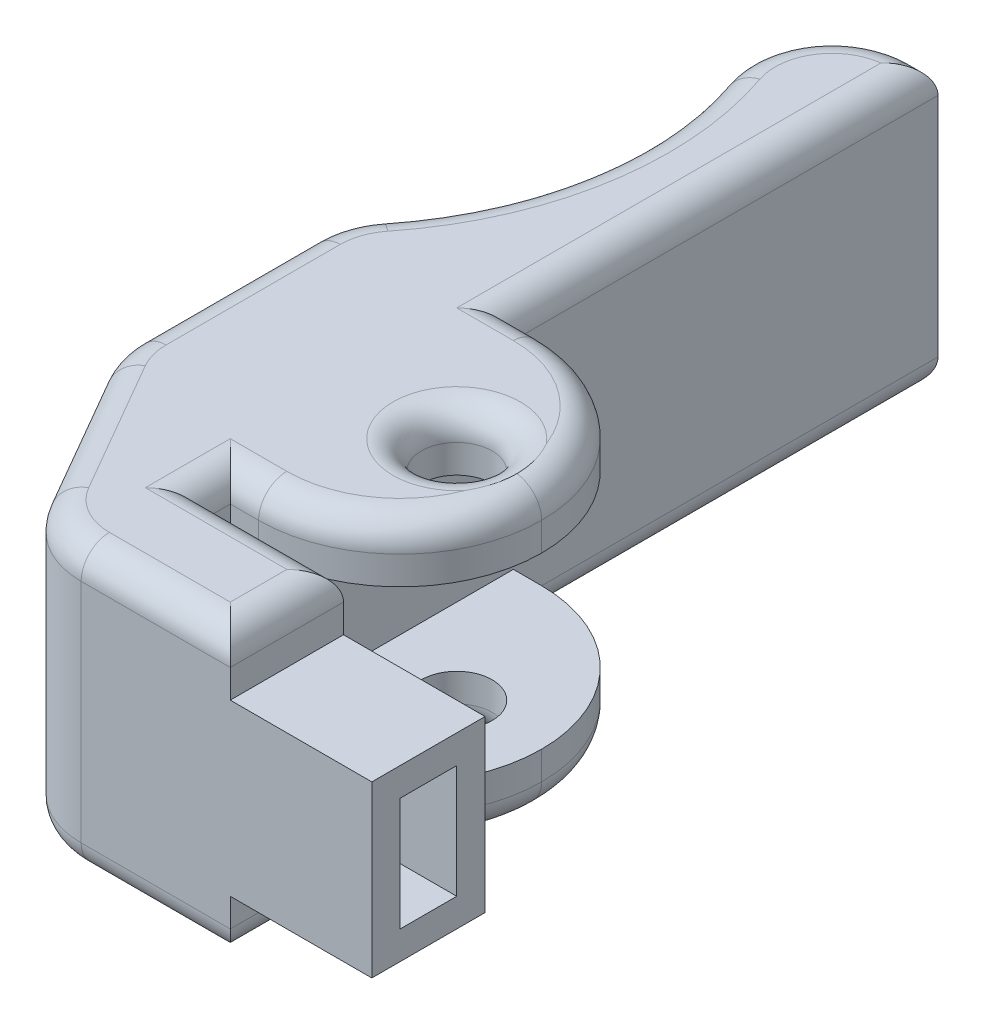
from build123d import *

# Parameters (mm, degrees)
CROQUIS1_W                 = 6
CROQUIS1_H                 = 10
CROQUIS1_R                 = 1.25
SALIENTE_EXTRUIR1_DEPTH    = 5
REDONDEO1_R                = 5
CROQUIS2_W                 = 4
CROQUIS2_H                 = 2
CORTAR_EXTRUIR1_DEPTH      = 5
CORTAR_EXTRUIR2_DEPTH      = 5
CORTAR_EXTRUIR2_DEPTH_BACK = 3
CROQUIS3_W                 = 5
CROQUIS3_H                 = 6
CROQUIS4_W                 = 2
CROQUIS4_H                 = 4
CORTAR_EXTRUIR3_DEPTH      = 2
CORTAR_EXTRUIR4_DEPTH      = 16
REDONDEO2_R                = 3
REDONDEO3_R                = 3
REDONDEO4_R                = 1


# Some blends are built 0.0001 mm under size
with BuildPart() as part:
    # Croquis1 → Saliente-Extruir1 (new, symmetric)
    # profile 1 of 2: a face of its own
    with BuildSketch(Plane(origin=(0, 0, 0), x_dir=(1, 0, 0), z_dir=(0, 1, 0))):
        Polygon((-3, -6), (-3, -5), (-3, 5), (-3, 20), (-9, 20), (-9, -3.07179677), (-5, -10), (7, -10), (7, -6), align=None)
    # profile 2 of 2: a face of its own
    with BuildSketch(Plane(origin=(0, 0, 0), x_dir=(1, 0, 0), z_dir=(0, 1, 0))):
        Rectangle(CROQUIS1_W, CROQUIS1_H)
        with Locations(Location((0, 0, 0), (0, 0, 270))):
            Circle(CROQUIS1_R, mode=Mode.SUBTRACT)
    extrude(amount=SALIENTE_EXTRUIR1_DEPTH, both=True)

    # Redondeo1
    redondeo1_edges = [part.edges().sort_by_distance(p)[0] for p in [
        (3, 0, 5),
        (3, 0, -5),
    ]]
    fillet(redondeo1_edges, radius=REDONDEO1_R - 0.0001)  # a hair under: the kernel refuses the full size

    # Croquis2 → Cortar-Extruir1 (cut)
    with BuildSketch(Plane(origin=(7, 0, 0), x_dir=(0, 0, -1), z_dir=(1, 0, 0))):
        with Locations((-8, 4)):
            Rectangle(CROQUIS2_W, CROQUIS2_H)
        with Locations((-8, -4)):
            Rectangle(CROQUIS2_W, CROQUIS2_H)
    extrude(amount=-CORTAR_EXTRUIR1_DEPTH, mode=Mode.SUBTRACT)

    # Croquis3 → Cortar-Extruir2 (cut, two sides: drawn at the far end of the back side and taken through both)
    with BuildSketch(Plane(origin=(0, 0, 0), x_dir=(0, 0, -1), z_dir=(1, 0, 0)).offset(-CORTAR_EXTRUIR2_DEPTH_BACK)):
        with Locations((2.5, 0)):
            Rectangle(CROQUIS3_W, CROQUIS3_H)
        with Locations((-2.5, 0)):
            Rectangle(CROQUIS3_W, CROQUIS3_H)
    extrude(amount=CORTAR_EXTRUIR2_DEPTH + CORTAR_EXTRUIR2_DEPTH_BACK, mode=Mode.SUBTRACT)

    # Croquis4 → Cortar-Extruir3 (cut)
    with BuildSketch(Plane(origin=(7, 0, 0), x_dir=(0, 0, -1), z_dir=(1, 0, 0))):
        with Locations((-8, 0)):
            Rectangle(CROQUIS4_W, CROQUIS4_H)
    extrude(amount=-CORTAR_EXTRUIR3_DEPTH, mode=Mode.SUBTRACT)

    # Croquis5 → Cortar-Extruir4 (cut, symmetric)
    with BuildSketch(Plane(origin=(0, 0, 0), x_dir=(1, 0, 0), z_dir=(0, 1, 0))):
        with BuildLine():
            Line((-9, 20), (-9, 5))
            ThreePointArc((-9, 5), (-6, 12.5), (-9, 20))
        make_face()
    extrude(amount=CORTAR_EXTRUIR4_DEPTH, both=True, mode=Mode.SUBTRACT)

    # Redondeo2
    redondeo2_edges = [part.edges().sort_by_distance(p)[0] for p in [
        (-9, 0, -20),
    ]]
    fillet(redondeo2_edges, radius=REDONDEO2_R)

    # Redondeo3
    redondeo3_edges = [part.edges().sort_by_distance(p)[0] for p in [
        (-9, 0, -5),
        (-5, 0, 10),
        (-9, 0, 3.07179677),
    ]]
    fillet(redondeo3_edges, radius=REDONDEO3_R)

    # Redondeo4
    # the kernel refuses this fillet: 1 mm, written as the material it takes off along each edge
    with BuildSketch(Plane(origin=(2, -5, 12.5), x_dir=(-1, 0, 0), z_dir=(0, 0, -1)), Plane(origin=(2, 5, 3.5), x_dir=(-1, 0, 0), z_dir=(0, 0, 1))) as redondeo4_piece_1:
        with BuildLine():
            CenterArc((REDONDEO4_R, REDONDEO4_R), REDONDEO4_R, 180, 90)
            Line((0, REDONDEO4_R), (0, 0))
            Line((0, 0), (REDONDEO4_R, 0))
        make_face()
    extrude(amount=9, mode=Mode.SUBTRACT)
    with BuildSketch(Plane(origin=(4.5, -5, 6), x_dir=(0, 0, 1), z_dir=(-1, 0, 0)), Plane(origin=(4.5, 5, 6), x_dir=(0, -1, 0), z_dir=(-1, 0, 0))) as redondeo4_piece_2:
        with BuildLine():
            CenterArc((REDONDEO4_R, REDONDEO4_R), REDONDEO4_R, 180, 90)
            Line((0, REDONDEO4_R), (0, 0))
            Line((0, 0), (REDONDEO4_R, 0))
        make_face()
    extrude(amount=7.5, mode=Mode.SUBTRACT)
    with BuildSketch(Plane(origin=(-3, -5, 6), x_dir=(-1, 0, 0), z_dir=(0, 0, -1))) as redondeo4_piece_3:
        with BuildLine():
            CenterArc((REDONDEO4_R, REDONDEO4_R), REDONDEO4_R, 180, 90)
            Line((0, REDONDEO4_R), (0, 0))
            Line((0, 0), (REDONDEO4_R, 0))
        make_face()
    extrude(amount=1, mode=Mode.SUBTRACT)
    with BuildSketch(Plane(origin=(-3, -5, 5), x_dir=(0, 0, -1), z_dir=(1, 0, 0)), Plane(origin=(-1.9999, -5, -5), x_dir=(0, 0, 1), z_dir=(-1, 0, 0))) as redondeo4_piece_4:
        with BuildLine():
            CenterArc((REDONDEO4_R, REDONDEO4_R), REDONDEO4_R, 180, 90)
            Line((0, REDONDEO4_R), (0, 0))
            Line((0, 0), (REDONDEO4_R, 0))
        make_face()
    extrude(amount=1.0001, mode=Mode.SUBTRACT)
    with BuildSketch(Plane(origin=(-1.9999, -5, 0.0001), x_dir=(0, 0, 1), z_dir=(-1, 0, 0))) as redondeo4_piece_5:
        with BuildLine():
            CenterArc((4.9999 - REDONDEO4_R, REDONDEO4_R), REDONDEO4_R, 270, 90)
            Line((4.9999, REDONDEO4_R), (4.9999, 0))
            Line((4.9999, 0), (4.9999 - REDONDEO4_R, 0))
        make_face()
    revolve(axis=Axis((-1.9999, -5, 0.0001), (0, 1, 0)), revolution_arc=90, mode=Mode.SUBTRACT)
    with BuildSketch(Plane(origin=(-1.9999, -5, -0.0001), x_dir=(1, 0, 0), z_dir=(0, 0, 1))) as redondeo4_piece_6:
        with BuildLine():
            CenterArc((4.9999 - REDONDEO4_R, REDONDEO4_R), REDONDEO4_R, 270, 90)
            Line((4.9999, REDONDEO4_R), (4.9999, 0))
            Line((4.9999, 0), (4.9999 - REDONDEO4_R, 0))
        make_face()
    revolve(axis=Axis((-1.9999, -5, -0.0001), (0, 1, 0)), revolution_arc=90, mode=Mode.SUBTRACT)
    with BuildSketch(Plane(origin=(-3, -5, -5), x_dir=(-1, 0, 0), z_dir=(0, 0, -1))) as redondeo4_piece_7:
        with BuildLine():
            CenterArc((REDONDEO4_R, REDONDEO4_R), REDONDEO4_R, 180, 90)
            Line((0, REDONDEO4_R), (0, 0))
            Line((0, 0), (REDONDEO4_R, 0))
        make_face()
    extrude(amount=17.5, mode=Mode.SUBTRACT)
    with BuildSketch(Plane(origin=(-3.75, -5, -17), x_dir=(-0.9459459459459457, 0, 0.32432432432432523), z_dir=(0.32432432432432523, 0, 0.9459459459459457))) as redondeo4_piece_8:
        with BuildLine():
            CenterArc((3 - REDONDEO4_R, -REDONDEO4_R), REDONDEO4_R, 0, 90)
            Line((3, -REDONDEO4_R), (3, 0))
            Line((3, 0), (3 - REDONDEO4_R, 0))
        make_face()
    revolve(axis=Axis((-3.75, -5, -17), (0, -1, 0)), revolution_arc=108.924644416, mode=Mode.SUBTRACT)
    with BuildSketch(Plane(origin=(-16.875, -5, -12.5), x_dir=(0.7837837837837833, 0, 0.6210337996257335), z_dir=(-0.6210337996257335, 0, 0.7837837837837833))) as redondeo4_piece_9:
        with BuildLine():
            CenterArc((10.875 + REDONDEO4_R, REDONDEO4_R), REDONDEO4_R, 180, 90)
            Line((10.875, REDONDEO4_R), (10.875, 0))
            Line((10.875, 0), (10.875 + REDONDEO4_R, 0))
        make_face()
    revolve(axis=Axis((-16.875, -5, -12.5), (0, 1, 0)), revolution_arc=57.316311778, mode=Mode.SUBTRACT)
    with BuildSketch(Plane(origin=(-6, -5, -3.88315603), x_dir=(-0.7837837837837837, 0, -0.621033799625733), z_dir=(0.621033799625733, 0, -0.7837837837837837))) as redondeo4_piece_10:
        with BuildLine():
            CenterArc((3 - REDONDEO4_R, REDONDEO4_R), REDONDEO4_R, 270, 90)
            Line((3, REDONDEO4_R), (3, 0))
            Line((3, 0), (3 - REDONDEO4_R, 0))
        make_face()
    revolve(axis=Axis((-6, -5, -3.88315603), (0, 1, 0)), revolution_arc=38.391667362, mode=Mode.SUBTRACT)
    with BuildSketch(Plane(origin=(-9, -5, -3.88315603), x_dir=(1, 0, 0), z_dir=(0, 0, 1)), Plane(origin=(-9, 5, -3.88315603), x_dir=(0, -1, 0), z_dir=(0, 0, 1))) as redondeo4_piece_11:
        with BuildLine():
            CenterArc((REDONDEO4_R, REDONDEO4_R), REDONDEO4_R, 180, 90)
            Line((0, REDONDEO4_R), (0, 0))
            Line((0, 0), (REDONDEO4_R, 0))
        make_face()
    extrude(amount=6.151105223, mode=Mode.SUBTRACT)
    with BuildSketch(Plane(origin=(-6, -5, 2.267949192), x_dir=(-1, 0, 0), z_dir=(0, 0, -1))) as redondeo4_piece_12:
        with BuildLine():
            CenterArc((3 - REDONDEO4_R, REDONDEO4_R), REDONDEO4_R, 270, 90)
            Line((3, REDONDEO4_R), (3, 0))
            Line((3, 0), (3 - REDONDEO4_R, 0))
        make_face()
    revolve(axis=Axis((-6, -5, 2.267949192), (0, 1, 0)), revolution_arc=30, mode=Mode.SUBTRACT)
    with BuildSketch(Plane(origin=(-8.598076211, -5, 3.767949192), x_dir=(0.8660254037844396, 0, -0.4999999999999982), z_dir=(0.4999999999999983, 0, 0.8660254037844397)), Plane(origin=(-8.598076211, 5, 3.767949192), x_dir=(0, -1, 0), z_dir=(0.4999999999999983, 0, 0.8660254037844397))) as redondeo4_piece_13:
        with BuildLine():
            CenterArc((REDONDEO4_R, REDONDEO4_R), REDONDEO4_R, 180, 90)
            Line((0, REDONDEO4_R), (0, 0))
            Line((0, 0), (REDONDEO4_R, 0))
        make_face()
    extrude(amount=5.464101615, mode=Mode.SUBTRACT)
    with BuildSketch(Plane(origin=(-3.267949192, -5, 7), x_dir=(-0.8660254037844399, 0, 0.4999999999999977), z_dir=(-0.4999999999999977, 0, -0.8660254037844399))) as redondeo4_piece_14:
        with BuildLine():
            CenterArc((3 - REDONDEO4_R, REDONDEO4_R), REDONDEO4_R, 270, 90)
            Line((3, REDONDEO4_R), (3, 0))
            Line((3, 0), (3 - REDONDEO4_R, 0))
        make_face()
    revolve(axis=Axis((-3.267949192, -5, 7), (0, 1, 0)), revolution_arc=60, mode=Mode.SUBTRACT)
    with BuildSketch(Plane(origin=(-3.267949192, -5, 10), x_dir=(0, 0, -1), z_dir=(1, 0, 0)), Plane(origin=(-3.267949192, 5, 10), x_dir=(0, -1, 0), z_dir=(1, 0, 0))) as redondeo4_piece_15:
        with BuildLine():
            CenterArc((REDONDEO4_R, REDONDEO4_R), REDONDEO4_R, 180, 90)
            Line((0, REDONDEO4_R), (0, 0))
            Line((0, 0), (REDONDEO4_R, 0))
        make_face()
    extrude(amount=7.767949192, mode=Mode.SUBTRACT)
    with BuildSketch(Plane(origin=(0, -5, 0), x_dir=(0, 0, 1), z_dir=(-1, 0, 0))) as redondeo4_piece_16:
        with BuildLine():
            CenterArc((1.25 + REDONDEO4_R, REDONDEO4_R), REDONDEO4_R, 180, 90)
            Line((1.25, REDONDEO4_R), (1.25, 0))
            Line((1.25, 0), (1.25 + REDONDEO4_R, 0))
        make_face()
    revolve(axis=Axis((0, -5, 0), (0, 1, 0)), mode=Mode.SUBTRACT)
    with BuildSketch(Plane(origin=(0, 5, 0), x_dir=(0, 0, 1), z_dir=(-1, 0, 0))) as redondeo4_piece_17:
        with BuildLine():
            CenterArc((1.25 + REDONDEO4_R, -REDONDEO4_R), REDONDEO4_R, 90, 90)
            Line((1.25, -REDONDEO4_R), (1.25, 0))
            Line((1.25, 0), (1.25 + REDONDEO4_R, 0))
        make_face()
    revolve(axis=Axis((0, 5, 0), (0, 1, 0)), mode=Mode.SUBTRACT)
    with BuildSketch(Plane(origin=(-6, 5, 2.267949192), x_dir=(-1, 0, 0), z_dir=(0, 0, -1))) as redondeo4_piece_18:
        with BuildLine():
            CenterArc((3 - REDONDEO4_R, -REDONDEO4_R), REDONDEO4_R, 0, 90)
            Line((3 - REDONDEO4_R, 0), (3, 0))
            Line((3, 0), (3, -REDONDEO4_R))
        make_face()
    revolve(axis=Axis((-6, 5, 2.267949192), (0, 1, 0)), revolution_arc=30, mode=Mode.SUBTRACT)
    with BuildSketch(Plane(origin=(-6, 5, -3.88315603), x_dir=(-0.7837837837837837, 0, -0.621033799625733), z_dir=(0.621033799625733, 0, -0.7837837837837837))) as redondeo4_piece_19:
        with BuildLine():
            CenterArc((3 - REDONDEO4_R, -REDONDEO4_R), REDONDEO4_R, 0, 90)
            Line((3 - REDONDEO4_R, 0), (3, 0))
            Line((3, 0), (3, -REDONDEO4_R))
        make_face()
    revolve(axis=Axis((-6, 5, -3.88315603), (0, 1, 0)), revolution_arc=38.391667362, mode=Mode.SUBTRACT)
    with BuildSketch(Plane(origin=(-16.875, 5, -12.5), x_dir=(0.7837837837837833, 0, 0.6210337996257335), z_dir=(-0.6210337996257335, 0, 0.7837837837837833))) as redondeo4_piece_20:
        with BuildLine():
            CenterArc((10.875 + REDONDEO4_R, -REDONDEO4_R), REDONDEO4_R, 90, 90)
            Line((10.875 + REDONDEO4_R, 0), (10.875, 0))
            Line((10.875, 0), (10.875, -REDONDEO4_R))
        make_face()
    revolve(axis=Axis((-16.875, 5, -12.5), (0, 1, 0)), revolution_arc=57.316311778, mode=Mode.SUBTRACT)
    with BuildSketch(Plane(origin=(-3.75, 5, -17), x_dir=(-0.9459459459459457, 0, 0.32432432432432523), z_dir=(0.32432432432432523, 0, 0.9459459459459457))) as redondeo4_piece_21:
        with BuildLine():
            CenterArc((3 - REDONDEO4_R, REDONDEO4_R), REDONDEO4_R, 270, 90)
            Line((3 - REDONDEO4_R, 0), (3, 0))
            Line((3, 0), (3, REDONDEO4_R))
        make_face()
    revolve(axis=Axis((-3.75, 5, -17), (0, -1, 0)), revolution_arc=108.924644416, mode=Mode.SUBTRACT)
    with BuildSketch(Plane(origin=(-3, 5, -22.5), x_dir=(0, -1, 0), z_dir=(0, 0, 1))) as redondeo4_piece_22:
        with BuildLine():
            CenterArc((REDONDEO4_R, -REDONDEO4_R), REDONDEO4_R, 90, 90)
            Line((0, -REDONDEO4_R), (0, 0))
            Line((0, 0), (REDONDEO4_R, 0))
        make_face()
    extrude(amount=17.5, mode=Mode.SUBTRACT)
    with BuildSketch(Plane(origin=(-1.9999, 5, -5), x_dir=(0, 0, 1), z_dir=(-1, 0, 0)), Plane(origin=(-3, 5, 5), x_dir=(0, 0, -1), z_dir=(1, 0, 0))) as redondeo4_piece_23:
        with BuildLine():
            CenterArc((REDONDEO4_R, -REDONDEO4_R), REDONDEO4_R, 90, 90)
            Line((0, -REDONDEO4_R), (0, 0))
            Line((0, 0), (REDONDEO4_R, 0))
        make_face()
    extrude(amount=1.0001, mode=Mode.SUBTRACT)
    with BuildSketch(Plane(origin=(-1.9999, 5, -0.0001), x_dir=(1, 0, 0), z_dir=(0, 0, 1))) as redondeo4_piece_24:
        with BuildLine():
            CenterArc((4.9999 - REDONDEO4_R, -REDONDEO4_R), REDONDEO4_R, 0, 90)
            Line((4.9999, -REDONDEO4_R), (4.9999, 0))
            Line((4.9999, 0), (4.9999 - REDONDEO4_R, 0))
        make_face()
    revolve(axis=Axis((-1.9999, 5, -0.0001), (0, 1, 0)), revolution_arc=90, mode=Mode.SUBTRACT)
    with BuildSketch(Plane(origin=(-1.9999, 5, 0.0001), x_dir=(0, 0, 1), z_dir=(-1, 0, 0))) as redondeo4_piece_25:
        with BuildLine():
            CenterArc((4.9999 - REDONDEO4_R, -REDONDEO4_R), REDONDEO4_R, 0, 90)
            Line((4.9999, -REDONDEO4_R), (4.9999, 0))
            Line((4.9999, 0), (4.9999 - REDONDEO4_R, 0))
        make_face()
    revolve(axis=Axis((-1.9999, 5, 0.0001), (0, 1, 0)), revolution_arc=90, mode=Mode.SUBTRACT)
    with BuildSketch(Plane(origin=(-3, 5, 5), x_dir=(0, -1, 0), z_dir=(0, 0, 1))) as redondeo4_piece_26:
        with BuildLine():
            CenterArc((REDONDEO4_R, -REDONDEO4_R), REDONDEO4_R, 90, 90)
            Line((0, -REDONDEO4_R), (0, 0))
            Line((0, 0), (REDONDEO4_R, 0))
        make_face()
    extrude(amount=1, mode=Mode.SUBTRACT)
    with BuildSketch(Plane(origin=(-3.267949192, 5, 7), x_dir=(-0.8660254037844399, 0, 0.4999999999999977), z_dir=(-0.4999999999999977, 0, -0.8660254037844399))) as redondeo4_piece_27:
        with BuildLine():
            CenterArc((3 - REDONDEO4_R, -REDONDEO4_R), REDONDEO4_R, 0, 90)
            Line((3 - REDONDEO4_R, 0), (3, 0))
            Line((3, 0), (3, -REDONDEO4_R))
        make_face()
    revolve(axis=Axis((-3.267949192, 5, 7), (0, 1, 0)), revolution_arc=60, mode=Mode.SUBTRACT)
    with BuildSketch(Plane(origin=(3, 5, 0.0001), x_dir=(-1, 0, 0), z_dir=(0, 0, -1))) as redondeo4_piece_28:
        with BuildLine():
            CenterArc((REDONDEO4_R, -REDONDEO4_R), REDONDEO4_R, 90, 90)
            Line((0, -REDONDEO4_R), (0, 0))
            Line((0, 0), (REDONDEO4_R, 0))
        make_face()
    extrude(amount=0.0002, mode=Mode.SUBTRACT)
    with BuildSketch(Plane(origin=(-0.5, 5, -20), x_dir=(0, -1, 0), z_dir=(-1, 0, 0)), Plane(origin=(-0.5, -5, -20), x_dir=(0, 0, 1), z_dir=(-1, 0, 0))) as redondeo4_piece_29:
        with BuildLine():
            CenterArc((REDONDEO4_R, REDONDEO4_R), REDONDEO4_R, 180, 90)
            Line((0, REDONDEO4_R), (0, 0))
            Line((0, 0), (REDONDEO4_R, 0))
        make_face()
    extrude(amount=3.25, mode=Mode.SUBTRACT)
    with BuildSketch(Plane(origin=(3, -5, 0.0001), x_dir=(-1, 0, 0), z_dir=(0, 0, -1))) as redondeo4_piece_30:
        with BuildLine():
            CenterArc((REDONDEO4_R, REDONDEO4_R), REDONDEO4_R, 180, 90)
            Line((0, REDONDEO4_R), (0, 0))
            Line((0, 0), (REDONDEO4_R, 0))
        make_face()
    extrude(amount=0.0002, mode=Mode.SUBTRACT)
    with BuildSketch(Plane(origin=(4.5, -5, 6), x_dir=(0, 0, 1), z_dir=(-1, 0, 0))) as redondeo4_piece_31a_section:
        with BuildLine():
            CenterArc((REDONDEO4_R, REDONDEO4_R), REDONDEO4_R, 180, 90)
            Line((0, REDONDEO4_R), (0, 0))
            Line((0, 0), (REDONDEO4_R, 0))
        make_face()
    redondeo4_piece_31a = extrude(amount=10, mode=Mode.PRIVATE)
    redondeo4_piece_31a = split(redondeo4_piece_31a, bisect_by=Plane(origin=(-3, -4.773604886, 6.226395114), z_dir=(-1, 0, 0)), keep=Keep.TOP, mode=Mode.PRIVATE)
    with BuildSketch(Plane(origin=(-3, -5, 8.5), x_dir=(-1, 0, 0), z_dir=(0, 0, -1))) as redondeo4_piece_31b_section:
        with BuildLine():
            CenterArc((REDONDEO4_R, REDONDEO4_R), REDONDEO4_R, 180, 90)
            Line((0, REDONDEO4_R), (0, 0))
            Line((0, 0), (REDONDEO4_R, 0))
        make_face()
    redondeo4_piece_31b = extrude(amount=3.5, mode=Mode.PRIVATE)
    redondeo4_piece_31b = split(redondeo4_piece_31b, bisect_by=Plane(origin=(-3.226395114, -4.773604886, 6), z_dir=(0, 0, 1)), keep=Keep.TOP, mode=Mode.PRIVATE)
    redondeo4_piece_31 = redondeo4_piece_31a & redondeo4_piece_31b
    add(redondeo4_piece_31, mode=Mode.SUBTRACT)
    with BuildSketch(Plane(origin=(-5.5, -5, 5), x_dir=(0, 0, -1), z_dir=(1, 0, 0))) as redondeo4_piece_32a_section:
        with BuildLine():
            CenterArc((REDONDEO4_R, REDONDEO4_R), REDONDEO4_R, 180, 90)
            Line((0, REDONDEO4_R), (0, 0))
            Line((0, 0), (REDONDEO4_R, 0))
        make_face()
    redondeo4_piece_32a = extrude(amount=3.5001, mode=Mode.PRIVATE)
    redondeo4_piece_32a = split(redondeo4_piece_32a, bisect_by=Plane(origin=(-3, -4.773604886, 4.773604886), z_dir=(-1, 0, 0)), keep=Keep.TOP, mode=Mode.PRIVATE)
    with BuildSketch(Plane(origin=(-3, -5, 6), x_dir=(-1, 0, 0), z_dir=(0, 0, -1))) as redondeo4_piece_32b_section:
        with BuildLine():
            CenterArc((REDONDEO4_R, REDONDEO4_R), REDONDEO4_R, 180, 90)
            Line((0, REDONDEO4_R), (0, 0))
            Line((0, 0), (REDONDEO4_R, 0))
        make_face()
    redondeo4_piece_32b = extrude(amount=3.5, mode=Mode.PRIVATE)
    redondeo4_piece_32b = split(redondeo4_piece_32b, bisect_by=Plane(origin=(-3.226395114, -4.773604886, 5), z_dir=(0, 0, -1)), keep=Keep.TOP, mode=Mode.PRIVATE)
    redondeo4_piece_32 = redondeo4_piece_32a & redondeo4_piece_32b
    add(redondeo4_piece_32, mode=Mode.SUBTRACT)
    with BuildSketch(Plane(origin=(-3, -5, -2.5), x_dir=(-1, 0, 0), z_dir=(0, 0, -1))) as redondeo4_piece_33a_section:
        with BuildLine():
            CenterArc((REDONDEO4_R, REDONDEO4_R), REDONDEO4_R, 180, 90)
            Line((0, REDONDEO4_R), (0, 0))
            Line((0, 0), (REDONDEO4_R, 0))
        make_face()
    redondeo4_piece_33a = extrude(amount=20, mode=Mode.PRIVATE)
    redondeo4_piece_33a = split(redondeo4_piece_33a, bisect_by=Plane(origin=(-3.226395114, -4.773604886, -5), z_dir=(0, 0, 1)), keep=Keep.TOP, mode=Mode.PRIVATE)
    with BuildSketch(Plane(origin=(-1.9999, -5, -5), x_dir=(0, 0, 1), z_dir=(-1, 0, 0))) as redondeo4_piece_33b_section:
        with BuildLine():
            CenterArc((REDONDEO4_R, REDONDEO4_R), REDONDEO4_R, 180, 90)
            Line((0, REDONDEO4_R), (0, 0))
            Line((0, 0), (REDONDEO4_R, 0))
        make_face()
    redondeo4_piece_33b = extrude(amount=3.5001, mode=Mode.PRIVATE)
    redondeo4_piece_33b = split(redondeo4_piece_33b, bisect_by=Plane(origin=(-3, -4.773604886, -4.773604886), z_dir=(-1, 0, 0)), keep=Keep.TOP, mode=Mode.PRIVATE)
    redondeo4_piece_33 = redondeo4_piece_33a & redondeo4_piece_33b
    add(redondeo4_piece_33, mode=Mode.SUBTRACT)
    with BuildSketch(Plane(origin=(-3, 5, -22.5), x_dir=(0, -1, 0), z_dir=(0, 0, 1))) as redondeo4_piece_34a_section:
        with BuildLine():
            CenterArc((REDONDEO4_R, -REDONDEO4_R), REDONDEO4_R, 90, 90)
            Line((0, -REDONDEO4_R), (0, 0))
            Line((0, 0), (REDONDEO4_R, 0))
        make_face()
    redondeo4_piece_34a = extrude(amount=20, mode=Mode.PRIVATE)
    redondeo4_piece_34a = split(redondeo4_piece_34a, bisect_by=Plane(origin=(-3.226395114, 4.773604886, -5), z_dir=(0, 0, 1)), keep=Keep.TOP, mode=Mode.PRIVATE)
    with BuildSketch(Plane(origin=(-1.9999, 5, -5), x_dir=(0, 0, 1), z_dir=(-1, 0, 0))) as redondeo4_piece_34b_section:
        with BuildLine():
            CenterArc((REDONDEO4_R, -REDONDEO4_R), REDONDEO4_R, 90, 90)
            Line((0, -REDONDEO4_R), (0, 0))
            Line((0, 0), (REDONDEO4_R, 0))
        make_face()
    redondeo4_piece_34b = extrude(amount=3.5001, mode=Mode.PRIVATE)
    redondeo4_piece_34b = split(redondeo4_piece_34b, bisect_by=Plane(origin=(-3, 4.773604886, -4.773604886), z_dir=(-1, 0, 0)), keep=Keep.TOP, mode=Mode.PRIVATE)
    redondeo4_piece_34 = redondeo4_piece_34a & redondeo4_piece_34b
    add(redondeo4_piece_34, mode=Mode.SUBTRACT)
    with BuildSketch(Plane(origin=(-3, 5, 2.5), x_dir=(0, -1, 0), z_dir=(0, 0, 1))) as redondeo4_piece_35a_section:
        with BuildLine():
            CenterArc((REDONDEO4_R, -REDONDEO4_R), REDONDEO4_R, 90, 90)
            Line((0, -REDONDEO4_R), (0, 0))
            Line((0, 0), (REDONDEO4_R, 0))
        make_face()
    redondeo4_piece_35a = extrude(amount=3.5, mode=Mode.PRIVATE)
    redondeo4_piece_35a = split(redondeo4_piece_35a, bisect_by=Plane(origin=(-3.226395114, 4.773604886, 5), z_dir=(0, 0, -1)), keep=Keep.TOP, mode=Mode.PRIVATE)
    with BuildSketch(Plane(origin=(-5.5, 5, 5), x_dir=(0, 0, -1), z_dir=(1, 0, 0))) as redondeo4_piece_35b_section:
        with BuildLine():
            CenterArc((REDONDEO4_R, -REDONDEO4_R), REDONDEO4_R, 90, 90)
            Line((0, -REDONDEO4_R), (0, 0))
            Line((0, 0), (REDONDEO4_R, 0))
        make_face()
    redondeo4_piece_35b = extrude(amount=3.5001, mode=Mode.PRIVATE)
    redondeo4_piece_35b = split(redondeo4_piece_35b, bisect_by=Plane(origin=(-3, 4.773604886, 4.773604886), z_dir=(-1, 0, 0)), keep=Keep.TOP, mode=Mode.PRIVATE)
    redondeo4_piece_35 = redondeo4_piece_35a & redondeo4_piece_35b
    add(redondeo4_piece_35, mode=Mode.SUBTRACT)
    with BuildSketch(Plane(origin=(-3, 5, 5), x_dir=(0, -1, 0), z_dir=(0, 0, 1))) as redondeo4_piece_36a_section:
        with BuildLine():
            CenterArc((REDONDEO4_R, -REDONDEO4_R), REDONDEO4_R, 90, 90)
            Line((0, -REDONDEO4_R), (0, 0))
            Line((0, 0), (REDONDEO4_R, 0))
        make_face()
    redondeo4_piece_36a = extrude(amount=3.5, mode=Mode.PRIVATE)
    redondeo4_piece_36a = split(redondeo4_piece_36a, bisect_by=Plane(origin=(-3.226395114, 4.773604886, 6), z_dir=(0, 0, 1)), keep=Keep.TOP, mode=Mode.PRIVATE)
    with BuildSketch(Plane(origin=(4.5, 5, 6), x_dir=(0, -1, 0), z_dir=(-1, 0, 0))) as redondeo4_piece_36b_section:
        with BuildLine():
            CenterArc((REDONDEO4_R, REDONDEO4_R), REDONDEO4_R, 180, 90)
            Line((0, REDONDEO4_R), (0, 0))
            Line((0, 0), (REDONDEO4_R, 0))
        make_face()
    redondeo4_piece_36b = extrude(amount=10, mode=Mode.PRIVATE)
    redondeo4_piece_36b = split(redondeo4_piece_36b, bisect_by=Plane(origin=(-3, 4.773604886, 6.226395114), z_dir=(-1, 0, 0)), keep=Keep.TOP, mode=Mode.PRIVATE)
    redondeo4_piece_36 = redondeo4_piece_36a & redondeo4_piece_36b
    add(redondeo4_piece_36, mode=Mode.SUBTRACT)


solid = part.part
